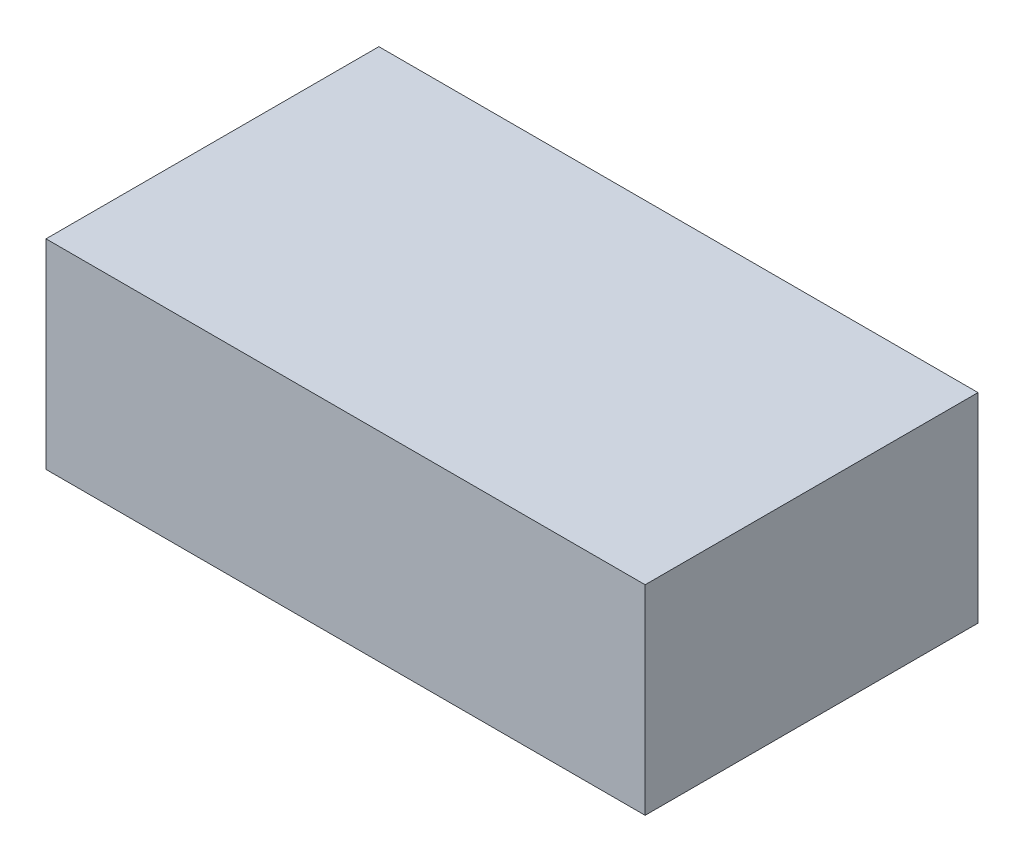
from build123d import *

# Parameters (mm, degrees)
SKETCH_1_W      = 180
SKETCH_1_H      = 100
EXTRUDE_1_DEPTH = 60


with BuildPart() as part:
    # Эскиз1 → Бобышка-Вытянуть1 (new body)
    with BuildSketch(Plane(origin=(0, 0, 0), x_dir=(1, 0, 0), z_dir=(0, 1, 0))):
        Rectangle(SKETCH_1_W, SKETCH_1_H)
    extrude(amount=EXTRUDE_1_DEPTH)


solid = part.part
